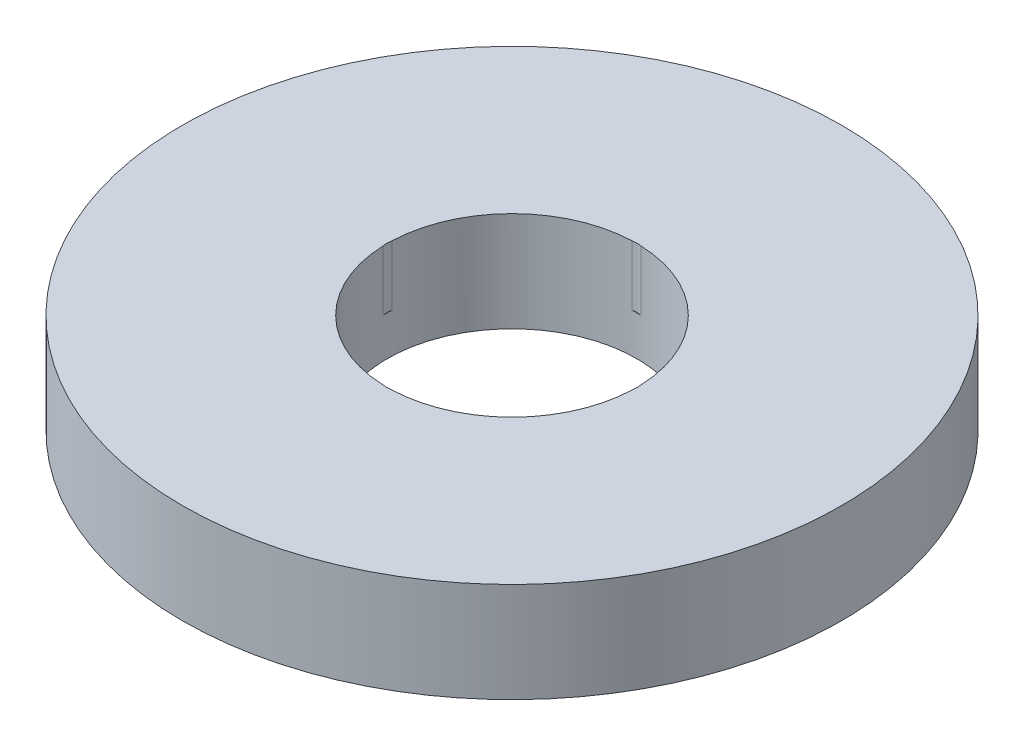
from build123d import *

# Parameters (mm, degrees)
SKETCH1_R           = 92.5
BOSS_EXTRUDE1_DEPTH = 28
SKETCH2_R           = 35
CUT_EXTRUDE1_DEPTH  = 134.777800849
SKETCH3_R           = 7.508170216
CUT_EXTRUDE2_DEPTH  = 16.854551782
CIRPATTERN1_COUNT   = 4


with BuildPart() as part:
    # Sketch1 → Boss-Extrude1 (new body)
    with BuildSketch(Plane(origin=(0, 0, 0), x_dir=(1, 0, 0), z_dir=(0, 1, 0))):
        Circle(SKETCH1_R)
    extrude(amount=BOSS_EXTRUDE1_DEPTH)

    # Sketch2 → Cut-Extrude1 (cut, through all)
    with BuildSketch(Plane(origin=(0, 0, 0), x_dir=(1, 0, 0), z_dir=(0, 1, 0))):
        Circle(SKETCH2_R)
    extrude(amount=CUT_EXTRUDE1_DEPTH, mode=Mode.SUBTRACT)

    # Sketch3 → Cut-Extrude2 (cut)
    with BuildSketch(Plane(origin=(0, 28, 0), x_dir=(1, 0, 0), z_dir=(0, 1, 0))):
        with Locations((-27.57348246, 0)):
            Circle(SKETCH3_R)
    cut_extrude2 = extrude(amount=-CUT_EXTRUDE2_DEPTH, mode=Mode.SUBTRACT)

    # CirPattern1: Cut-Extrude2 ×4 about axis
    cirpattern1_axis = Axis((0, 0, 0), (0, 1, 0))
    for i in range(1, CIRPATTERN1_COUNT):
        add(cut_extrude2.rotate(cirpattern1_axis, i * 360 / CIRPATTERN1_COUNT), mode=Mode.SUBTRACT)


solid = part.part
